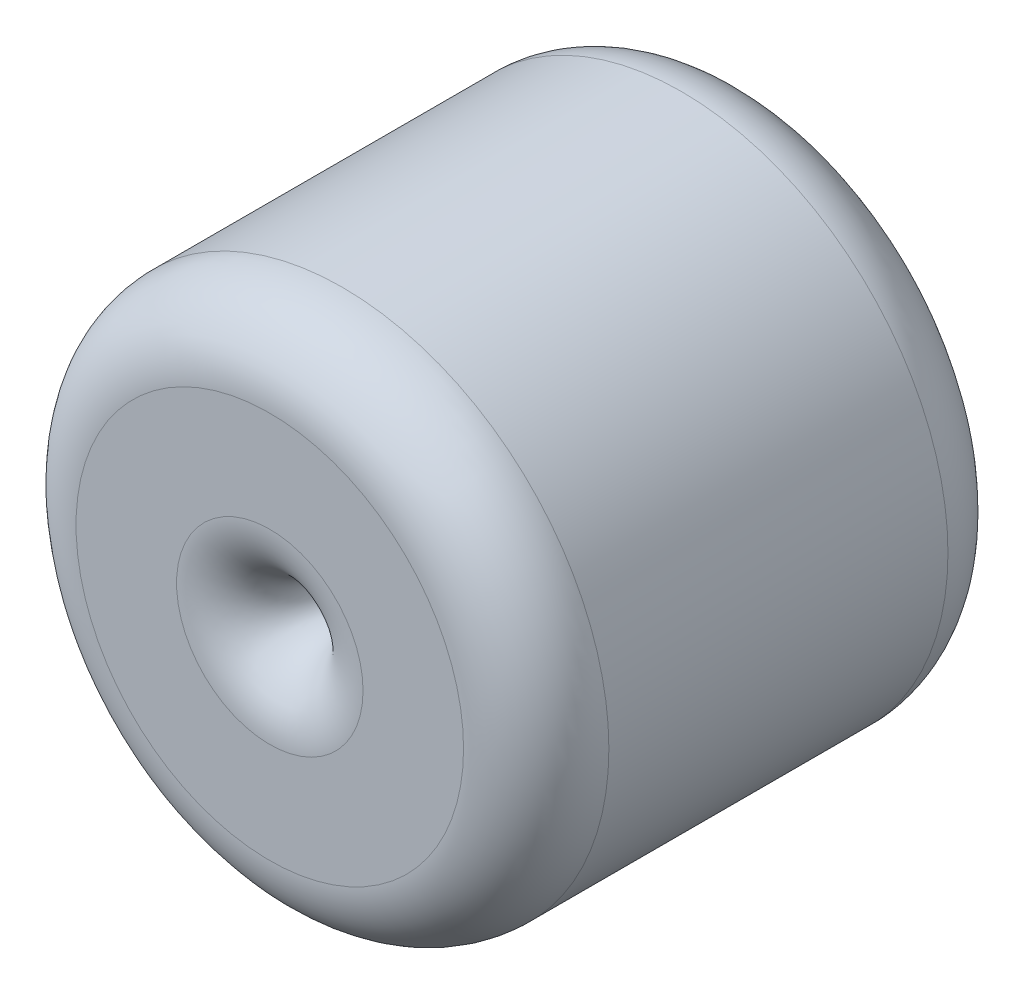
from build123d import *

# Parameters (mm, degrees)
SKETCH_1_R      = 22
SKETCH_1_R_2    = 1.7
EXTRUDE_1_DEPTH = 20
FILLET_1_R      = 6


with BuildPart() as part:
    # 草图1 → 凸台-拉伸1 (new, symmetric)
    with BuildSketch(Plane.XY):
        Circle(SKETCH_1_R)
        Circle(SKETCH_1_R_2, mode=Mode.SUBTRACT)
    extrude(amount=EXTRUDE_1_DEPTH, both=True)

    # 圆角1
    fillet_1_edges = [part.edges().sort_by_distance(p)[0] for p in [
        (-1.7, 0, -20),
        (-1.7, 0, 20),
        (-22, 0, -20),
        (-22, 0, 20),
    ]]
    fillet(fillet_1_edges, radius=FILLET_1_R)


solid = part.part
